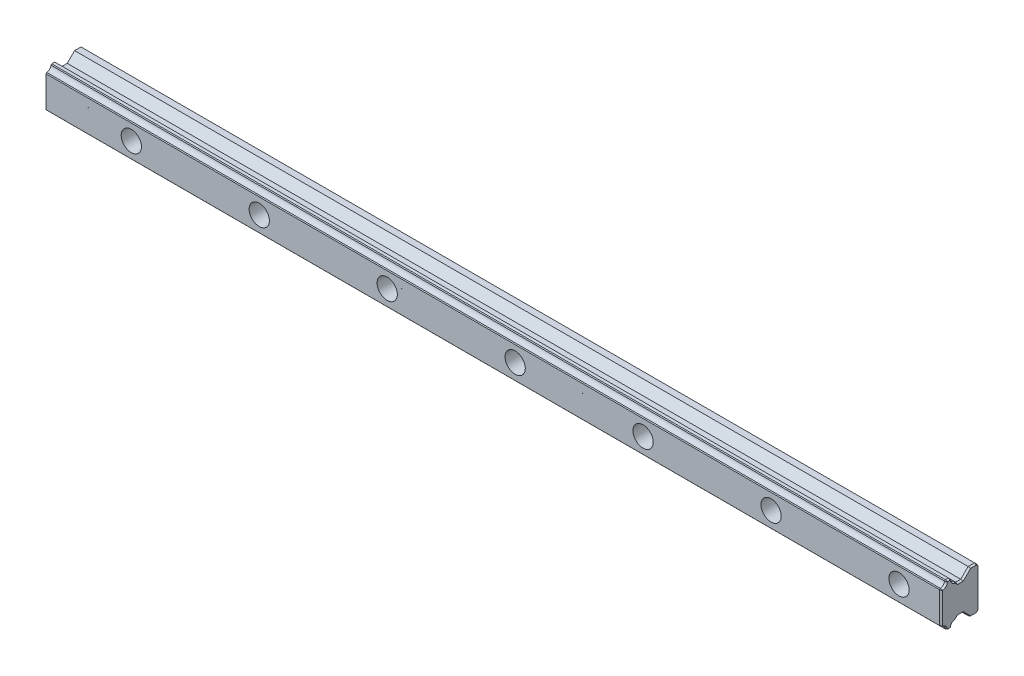
from build123d import *

# Parameters (mm, degrees)
BOSS_EXTRUDE1_DEPTH = 1000
SKETCH2_W           = 1000
SKETCH2_H           = 7.450095573
BOSS_EXTRUDE2_DEPTH = 3.4498578
SKETCH3_W           = 1000
SKETCH3_H           = 3.9997559
BOSS_EXTRUDE3_DEPTH = 3.4501422
DRAFT1_ANGLE        = 45.002080143
DRAFT2_ANGLE        = 45.004001238
HOLE1_D             = 4.26
HOLE2_D             = 6
HOLE2_CBORE_D       = 9.5
HOLE2_CBORE_DEPTH   = 8.4
CHAMFER1_SIZE       = 0.372012979
CHAMFER2_SIZE       = 0.361963418
CHAMFER3_SIZE       = 1
CHAMFER4_SIZE       = 0.371519866
CHAMFER5_SIZE       = 0.363970234
CHAMFER5_SIZE_2     = 1
SKETCH8_W           = 580
SKETCH8_H           = 21.756808221
CUT_EXTRUDE1_DEPTH  = 981.205469728


with BuildPart() as part:
    # Sketch1 → Boss-Extrude1 (new body)
    with BuildSketch(Plane(origin=(980, 0, 0), x_dir=(0, 0, -1), z_dir=(1, 0, 0))):
        with BuildLine():
            Line((-9.879942, -6.5501422), (0, -6.5501422))
            Line((0, -6.5501422), (0, 6.5498578))
            Line((0, 6.5498578), (-9.8792889, 6.5498578))
            Line((-9.8792889, 6.5498578), (-10.98751021, 7.658080112))
            ThreePointArc((-10.98751021, 7.658080112), (-12.443339621, 8.424671607), (-12.918625382, 9.9998558))
            Line((-12.918625382, 9.9998558), (-17.4, 9.9998558))
            Line((-17.4, 9.9998558), (-17.4, -10.0001442))
            Line((-17.4, -10.0001442), (-12.918646144, -10.0001442))
            ThreePointArc((-12.918646144, -10.0001442), (-12.443576435, -8.425447232), (-10.98845212, -7.658651955))
            Line((-10.98845212, -7.658651955), (-9.879942, -6.5501422))
        make_face()
    extrude(amount=-BOSS_EXTRUDE1_DEPTH)

    # Sketch2 → Boss-Extrude2 (add)
    with BuildSketch(Plane.XZ.offset(6.5501422)):
        with Locations((480, 3.725047787)):
            Rectangle(SKETCH2_W, SKETCH2_H)
    extrude(amount=BOSS_EXTRUDE2_DEPTH)

    # Sketch3 → Boss-Extrude3 (add)
    with BuildSketch(Plane(origin=(0, 6.5498578, 0), x_dir=(-1, 0, 0), z_dir=(0, 1, 0))):
        with Locations((-480, 1.99987795)):
            Rectangle(SKETCH3_W, SKETCH3_H)
    extrude(amount=BOSS_EXTRUDE3_DEPTH)

    # Draft1
    draft1_faces = [part.faces().sort_by_distance(p)[0] for p in [
        (480, 8.2749289, 3.9997559),
    ]]
    draft(draft1_faces, Plane.ZX.offset(10), DRAFT1_ANGLE)

    # Draft2
    draft2_faces = [part.faces().sort_by_distance(p)[0] for p in [
        (480, -8.2750711, 7.450095573),
    ]]
    draft(draft2_faces, Plane(origin=(-20, -6.5501422, 9.879942), x_dir=(0, 0, -1), z_dir=(0, -1, 0)), DRAFT2_ANGLE)

    # Hole1 (through all)
    with Locations(Plane.ZY.offset(20)):
        with Locations((17.19973415, 9.78005665), (17.19973415, -9.78030085)):
            Hole(HOLE1_D / 2)

    # Hole2 (through all)
    with Locations(Plane.XY.offset(17.4)):
        with Locations((960, 0), (900, 0), (840, 0), (780, 0), (720, 0), (660, 0), (600, 0), (540, 0), (480, 0), (420, 0), (360, 0), (300, 0), (240, 0), (180, 0), (120, 0), (60, 0), (0, 0)):
            CounterBoreHole(HOLE2_D / 2, HOLE2_CBORE_D / 2, HOLE2_CBORE_DEPTH)

    # Chamfer1
    # the kernel refuses this chamfer: 0.372012979, 0.338849035 mm, written as the material it takes off along each edge
    with BuildSketch(Plane(origin=(980.956699451, -10.0001442, 12.918646144), x_dir=(0, 0, 1), z_dir=(-1, 0, 0))) as chamfer1_piece_1:
        with BuildLine():
            Line((CHAMFER1_SIZE * 0.999999998756, 0), (0.006380544, 0.365632364))
            ThreePointArc((0.006380544, 0.365632364), (0.011135852, 0.187879029), (0, 0))
            Line((0, 0), (CHAMFER1_SIZE * 0.999999998756, 0))
        make_face()
    extrude(amount=1001.913398901, mode=Mode.SUBTRACT)

    # Chamfer2
    # the kernel refuses this chamfer: 0.361963418, 0.332200971, 0.329701008, 0.329695423 mm, written as the material it takes off along each edge
    with BuildSketch(Plane(origin=(-20.930855163, -10.0001442, 15.081109855), x_dir=(0, 0, -1), z_dir=(1, 0, 0))) as chamfer2_piece_1:
        with BuildLine():
            Line((CHAMFER2_SIZE * 0.999999998629, 0), (0.007091411, 0.354872006))
            ThreePointArc((0.007091411, 0.354872006), (0.011045386, 0.182332682), (0, 0))
            Line((0, 0), (CHAMFER2_SIZE * 0.999999998629, 0))
        make_face()
    extrude(amount=1001.861710326, mode=Mode.SUBTRACT)
    with BuildSketch(Plane(origin=(-20.930855163, -7.659736399, 17.4), x_dir=(0, 0.00992372921433692, -0.9999507585868819), z_dir=(1, 0, 0))) as chamfer2_piece_2:
        with BuildLine():
            Line((0.358424162, 0), (CHAMFER2_SIZE * 0.00992372920073, CHAMFER2_SIZE * 0.999950757216))
            Line((CHAMFER2_SIZE * 0.00992372920073, CHAMFER2_SIZE * 0.999950757216), (0, 0))
            ThreePointArc((0, 0), (0.184310403, 0.007546483), (0.358424162, 0))
        make_face()
    extrude(amount=1001.861710326, mode=Mode.SUBTRACT)
    with BuildSketch(Plane(origin=(-20.930855163, 7.659492199, 17.4), x_dir=(0, -1, 0), z_dir=(1, 0, 0))) as chamfer2_piece_3:
        with BuildLine():
            Line((CHAMFER2_SIZE * 0.999999998629, 0), (0.003556904, 0.358406513))
            ThreePointArc((0.003556904, 0.358406513), (0.009375158, 0.184226438), (0, 0))
            Line((0, 0), (CHAMFER2_SIZE * 0.999999998629, 0))
        make_face()
    extrude(amount=1001.861710326, mode=Mode.SUBTRACT)
    with BuildSketch(Plane(origin=(-20.930855163, 9.9998558, 15.081105269), x_dir=(0, -0.9998008523761441, -0.019956342047966567), z_dir=(1, 0, 0))) as chamfer2_piece_4:
        with BuildLine():
            Line((0.35495059, 0), (CHAMFER2_SIZE * 0.0199563420206, CHAMFER2_SIZE * 0.999800851005))
            Line((CHAMFER2_SIZE * 0.0199563420206, CHAMFER2_SIZE * 0.999800851005), (0, 0))
            ThreePointArc((0, 0), (0.182520953, 0.007400676), (0.35495059, 0))
        make_face()
    extrude(amount=1001.861710326, mode=Mode.SUBTRACT)

    # Chamfer3
    chamfer3_edges = [part.edges().sort_by_distance(p)[0] for p in [
        (480, -10, 0),
        (480, 10, 0),
    ]]
    chamfer(chamfer3_edges, length=CHAMFER3_SIZE)

    # Chamfer4
    # the kernel refuses this chamfer: 0.371519866, 0.338374363 mm, written as the material it takes off along each edge
    with BuildSketch(Plane(origin=(980.955431303, 9.9998558, 12.918625382), x_dir=(0, -0.9998437779419388, 0.017675398462010005), z_dir=(-1, 0, 0))) as chamfer4_piece_1:
        with BuildLine():
            Line((0.365123625, 0), (CHAMFER4_SIZE * 0.0176753984456, CHAMFER4_SIZE * 0.999843777013))
            Line((CHAMFER4_SIZE * 0.0176753984456, CHAMFER4_SIZE * 0.999843777013), (0, 0))
            ThreePointArc((0, 0), (0.187754336, 0.007831758), (0.365123625, 0))
        make_face()
    extrude(amount=1001.910862607, mode=Mode.SUBTRACT)

    # Chamfer5
    # the kernel refuses this chamfer: 1, 0.363970234 mm, written as the material it takes off along each edge
    with BuildSketch(Plane(origin=(980, 9.77981245, 10.80002185), x_dir=(0, -0.42648637425097896, -0.9044939870326689), z_dir=(0, 0.9044939870326689, -0.42648637425097896))) as chamfer5_piece_1:
        Polygon((2.13 + CHAMFER5_SIZE, 0), (2.13, CHAMFER5_SIZE_2), (2.13, 0), align=None)
    revolve(axis=Axis((980, 9.77981245, 10.80002185), (-1, 0, 0)), revolution_arc=220.656237873, mode=Mode.SUBTRACT)
    with BuildSketch(Plane(origin=(980, 4.715484283, 8.044917043), x_dir=(0, -0.7071064613613919, 0.7071071010115584), z_dir=(0, 0.7071071010115584, 0.7071064613613921))) as chamfer5_piece_2_section:
        Polygon((CHAMFER5_SIZE, 0), (0, -CHAMFER5_SIZE_2), (0, 0), align=None)
    chamfer5_piece_2 = extrude(amount=6.75565178, mode=Mode.PRIVATE)
    chamfer5_piece_2 = split(chamfer5_piece_2, bisect_by=Plane(origin=(980, 6.5498578, 8.044917043), z_dir=(0, 1, 0)), keep=Keep.TOP, mode=Mode.PRIVATE)
    add(chamfer5_piece_2, mode=Mode.SUBTRACT)
    with BuildSketch(Plane(origin=(980, -6.5501422, 12.474136733), x_dir=(0, 1, 0), z_dir=(0, 0, -1))) as chamfer5_piece_3_section:
        Polygon((CHAMFER5_SIZE, 0), (0, -CHAMFER5_SIZE_2), (0, 0), align=None)
    chamfer5_piece_3 = extrude(amount=7.618235892, mode=Mode.PRIVATE)
    chamfer5_piece_3 = split(chamfer5_piece_3, bisect_by=Plane(origin=(980, -4.038121645, 9.962467006), z_dir=(0, -0.7071561601012581, 0.7070573988233514)), keep=Keep.TOP, mode=Mode.PRIVATE)
    chamfer5_piece_3 = split(chamfer5_piece_3, bisect_by=Plane(origin=(980, -7.847239567, 11.177039793), z_dir=(0, -0.7071068974739103, -0.7071066648991656)), keep=Keep.TOP, mode=Mode.PRIVATE)
    add(chamfer5_piece_3, mode=Mode.SUBTRACT)
    with BuildSketch(Plane(origin=(980, -9.493024341, 12.822825109), x_dir=(0, 0.7071068974739103, 0.7071066648991655), z_dir=(0, 0.7071066648991656, -0.7071068974739103))) as chamfer5_piece_4_section:
        Polygon((CHAMFER5_SIZE, 0), (0, -CHAMFER5_SIZE_2), (0, 0), align=None)
    chamfer5_piece_4 = extrude(amount=6.756059252, mode=Mode.PRIVATE)
    chamfer5_piece_4 = split(chamfer5_piece_4, bisect_by=Plane(origin=(980, -6.5501422, 12.822825109), z_dir=(0, -1, 0)), keep=Keep.TOP, mode=Mode.PRIVATE)
    add(chamfer5_piece_4, mode=Mode.SUBTRACT)
    with BuildSketch(Plane(origin=(980, -9.78030085, 10.80002185), x_dir=(0, -0.9126940639173625, 0.4086435435560058), z_dir=(0, -0.4086435435560058, -0.9126940639173625))) as chamfer5_piece_5:
        Polygon((2.13 + CHAMFER5_SIZE, 0), (2.13, CHAMFER5_SIZE_2), (2.13, 0), align=None)
    revolve(axis=Axis((980, -9.78030085, 10.80002185), (-1, 0, 0)), revolution_arc=220.610102929, mode=Mode.SUBTRACT)
    with BuildSketch(Plane(origin=(980, -11.834516709, 15.125031988), x_dir=(0, 0.7071068497715801, 0.7071067126015084), z_dir=(0, 0.7071067126015084, -0.70710684977158))) as chamfer5_piece_6:
        Polygon((CHAMFER5_SIZE, 0), (0, -CHAMFER5_SIZE_2), (0, 0), align=None)
    extrude(amount=5.705471763, mode=Mode.SUBTRACT)
    with BuildSketch(Plane(origin=(980, 9.78005665, 17.19973415), x_dir=(4.803669199504906e-13, 0.9147457522504255, -0.40402996020072945), z_dir=(2.0897664314390657e-13, 0.40402996020072945, 0.9147457522504255))) as chamfer5_piece_7:
        Polygon((2.13 + CHAMFER5_SIZE, 0), (2.13, CHAMFER5_SIZE_2), (2.13, 0), align=None)
    revolve(axis=Axis((980, 9.78005665, 17.19973415), (-1, 0, 0)), revolution_arc=221.717516402, mode=Mode.SUBTRACT)
    with BuildSketch(Plane(origin=(980, -10.0001442, 17.313341171), x_dir=(0, 1, 0), z_dir=(0, 0, -1)), Plane(origin=(-20, -10.0001442, 17.313341171), x_dir=(1, 0, 0), z_dir=(0, 0, -1))) as chamfer5_piece_8:
        Polygon((CHAMFER5_SIZE, 0), (0, -CHAMFER5_SIZE_2), (0, 0), align=None)
    extrude(amount=6.61687678, mode=Mode.SUBTRACT)
    with BuildSketch(Plane(origin=(980, 9.891723514, 17.4), x_dir=(0, 0, -1), z_dir=(0, -1, 0)), Plane(origin=(-20, 9.891723514, 17.4), x_dir=(1, 0, 0), z_dir=(0, -1, 0))) as chamfer5_piece_9:
        Polygon((CHAMFER5_SIZE, 0), (0, -CHAMFER5_SIZE_2), (0, 0), align=None)
    extrude(amount=19.783691229, mode=Mode.SUBTRACT)
    with BuildSketch(Plane(origin=(980, -9.78030085, 17.19973415), x_dir=(0, 0.4139328204995242, 0.910307431647852), z_dir=(-4.8803031300112123e-14, -0.910307431647852, 0.4139328204995242))) as chamfer5_piece_10:
        Polygon((2.13 + CHAMFER5_SIZE, 0), (2.13, CHAMFER5_SIZE_2), (2.13, 0), align=None)
    revolve(axis=Axis((980, -9.78030085, 17.19973415), (-1, 0, 0)), revolution_arc=221.718922177, mode=Mode.SUBTRACT)
    with BuildSketch(Plane(origin=(980, -5.463400295, 19.234372687), x_dir=(0, 0.7071067811866485, -0.7071067811864467), z_dir=(0, -0.7071067811864467, -0.7071067811866485)), Plane(origin=(980, 9.490307982, 15.2072208), x_dir=(0, -0.7071067811858096, -0.7071067811872856), z_dir=(0, -0.7071067811872856, 0.7071067811858095))) as chamfer5_piece_11:
        Polygon((CHAMFER5_SIZE, 0), (0, -CHAMFER5_SIZE_2), (0, 0), align=None)
    extrude(amount=5.695252817, mode=Mode.SUBTRACT)
    with BuildSketch(Plane(origin=(980, -7.810899507, 16.908391131), x_dir=(-3.123520195293368e-13, 0.7071067811862966, -0.7071067811867984), z_dir=(0, -0.7071067811867985, -0.7071067811862967))) as chamfer5_piece_12:
        Polygon((CHAMFER5_SIZE, 0), (0, -CHAMFER5_SIZE_2), (0, 0), align=None)
    extrude(amount=5.690254269, mode=Mode.SUBTRACT)
    with BuildSketch(Plane(origin=(980, 11.834228487, 12.884769165), x_dir=(0, -0.7071067811866217, -0.7071067811864734), z_dir=(0, -0.7071067811864734, 0.7071067811866217))) as chamfer5_piece_13:
        Polygon((CHAMFER5_SIZE, 0), (0, -CHAMFER5_SIZE_2), (0, 0), align=None)
    extrude(amount=5.690265436, mode=Mode.SUBTRACT)
    with BuildSketch(Plane(origin=(980, -10, 6.593950633), x_dir=(0, 1, 0), z_dir=(0, 0, -1)), Plane(origin=(980, 10, -1.594194733), x_dir=(0, -1, 0), z_dir=(0, 0, 1))) as chamfer5_piece_14:
        Polygon((CHAMFER5_SIZE, 0), (0, -CHAMFER5_SIZE_2), (0, 0), align=None)
    extrude(amount=8.188145365, mode=Mode.SUBTRACT)
    with BuildSketch(Plane(origin=(980, -11.594194733, 0), x_dir=(0, 0, 1), z_dir=(0, 1, 0))) as chamfer5_piece_15:
        Polygon((CHAMFER5_SIZE, 0), (0, -CHAMFER5_SIZE_2), (0, 0), align=None)
    extrude(amount=23.188389465, mode=Mode.SUBTRACT)
    with BuildSketch(Plane(origin=(980, 11.834372687, 2.834372687), x_dir=(-3.123520195293376e-13, -0.7071067811865475, 0.7071067811865475), z_dir=(0, -0.7071067811865476, -0.7071067811865476)), Plane(origin=(980, -7.165627313, -1.834372687), x_dir=(0, 0.7071067811865476, 0.7071067811865476), z_dir=(0, -0.7071067811865476, 0.7071067811865476)), Plane(origin=(-20, 11.834372687, 2.834372687), x_dir=(1, 0, 0), z_dir=(0, -0.7071067811865476, -0.7071067811865476)), Plane(origin=(-20, -7.165627313, -1.834372687), x_dir=(1, 0, 0), z_dir=(0, -0.7071067811865476, 0.7071067811865476))) as chamfer5_piece_16:
        Polygon((CHAMFER5_SIZE, 0), (0, CHAMFER5_SIZE_2), (0, 0), align=None)
    extrude(amount=6.602603027, mode=Mode.SUBTRACT)
    with BuildSketch(Plane(origin=(980, 9.9998558, 10.695950515), x_dir=(0, -1, 0), z_dir=(0, 0, 1)), Plane(origin=(-20, 9.9998558, 10.695950515), x_dir=(1, 0, 0), z_dir=(0, 0, 1))) as chamfer5_piece_17:
        Polygon((CHAMFER5_SIZE, 0), (0, -CHAMFER5_SIZE_2), (0, 0), align=None)
    extrude(amount=6.61738607, mode=Mode.SUBTRACT)
    with BuildSketch(Plane(origin=(980, 7.80041546, 11.090707467), x_dir=(0, -0.7071063697090587, 0.707107192663797), z_dir=(0, 0.7071071926637971, 0.7071063697090587))) as chamfer5_piece_18:
        Polygon((CHAMFER5_SIZE, 0), (0, -CHAMFER5_SIZE_2), (0, 0), align=None)
    extrude(amount=5.70467128, mode=Mode.SUBTRACT)
    with BuildSketch(Plane(origin=(980, -4.715897621, 9.284596359), x_dir=(0, 0.7071561601012583, -0.7070573988233513), z_dir=(0, -0.7070573988233514, -0.7071561601012581))) as chamfer5_piece_19_section:
        Polygon((CHAMFER5_SIZE, 0), (0, -CHAMFER5_SIZE_2), (0, 0), align=None)
    chamfer5_piece_19 = extrude(amount=10.067565902, mode=Mode.PRIVATE)
    chamfer5_piece_19 = split(chamfer5_piece_19, bisect_by=Plane(origin=(980, -6.5501422, 9.284596359), z_dir=(0, -1, 0)), keep=Keep.TOP, mode=Mode.PRIVATE)
    add(chamfer5_piece_19, mode=Mode.SUBTRACT)
    with BuildSketch(Plane(origin=(980, 6.5498578, 4.855953894), x_dir=(0, -1, 0), z_dir=(0, 0, 1))) as chamfer5_piece_20_section:
        Polygon((CHAMFER5_SIZE, 0), (0, -CHAMFER5_SIZE_2), (0, 0), align=None)
    chamfer5_piece_20 = extrude(amount=7.617529739, mode=Mode.PRIVATE)
    chamfer5_piece_20 = split(chamfer5_piece_20, bisect_by=Plane(origin=(980, 4.038190297, 7.367623669), z_dir=(0, 0.7071064613613921, -0.7071071010115584)), keep=Keep.TOP, mode=Mode.PRIVATE)
    chamfer5_piece_20 = split(chamfer5_piece_20, bisect_by=Plane(origin=(980, 7.846955163, 6.152957077), z_dir=(0, 0.7071324524796995, 0.7070811089613734)), keep=Keep.TOP, mode=Mode.PRIVATE)
    add(chamfer5_piece_20, mode=Mode.SUBTRACT)
    with BuildSketch(Plane(origin=(980, 4.715551711, 9.28458791), x_dir=(0, -0.7071324524796995, -0.7070811089613733), z_dir=(0, 0.7070811089613734, -0.7071324524796995))) as chamfer5_piece_21_section:
        Polygon((CHAMFER5_SIZE, 0), (0, CHAMFER5_SIZE_2), (0, 0), align=None)
    chamfer5_piece_21 = extrude(amount=10.067804509, mode=Mode.PRIVATE)
    chamfer5_piece_21 = split(chamfer5_piece_21, bisect_by=Plane(origin=(980, 6.5498578, 9.28458791), z_dir=(0, 1, 0)), keep=Keep.TOP, mode=Mode.PRIVATE)
    add(chamfer5_piece_21, mode=Mode.SUBTRACT)
    with BuildSketch(Plane(origin=(-20, 4.715484283, 8.044917043), x_dir=(1, 0, 0), z_dir=(0, 0.7071071010115584, 0.7071064613613921))) as chamfer5_piece_22_section:
        Polygon((CHAMFER5_SIZE, 0), (0, -CHAMFER5_SIZE_2), (0, 0), align=None)
    chamfer5_piece_22 = extrude(amount=6.75565178, mode=Mode.PRIVATE)
    chamfer5_piece_22 = split(chamfer5_piece_22, bisect_by=Plane(origin=(-20, 6.5498578, 8.044917043), z_dir=(0, 1, 0)), keep=Keep.TOP, mode=Mode.PRIVATE)
    add(chamfer5_piece_22, mode=Mode.SUBTRACT)
    with BuildSketch(Plane(origin=(-20, -9.78030085, 10.80002185), x_dir=(0, -0.9126940639173421, 0.4086435435560518), z_dir=(0, -0.4086435435560518, -0.9126940639173421))) as chamfer5_piece_23:
        Polygon((2.13, -CHAMFER5_SIZE), (2.13 + CHAMFER5_SIZE_2, 0), (2.13, 0), align=None)
    revolve(axis=Axis((-20, -9.78030085, 10.80002185), (-1, 0, 0)), revolution_arc=220.610102929, mode=Mode.SUBTRACT)
    with BuildSketch(Plane(origin=(-20, 9.77981245, 10.80002185), x_dir=(0, -0.42648637425102415, -0.9044939870326476), z_dir=(0, 0.9044939870326476, -0.42648637425102415))) as chamfer5_piece_24:
        Polygon((2.13, -CHAMFER5_SIZE), (2.13 + CHAMFER5_SIZE_2, 0), (2.13, 0), align=None)
    revolve(axis=Axis((-20, 9.77981245, 10.80002185), (-1, 0, 0)), revolution_arc=220.656237873, mode=Mode.SUBTRACT)
    with BuildSketch(Plane(origin=(-20, 9.78005665, 17.19973415), x_dir=(0, -0.41393283318023105, 0.9103074258817112), z_dir=(0, 0.9103074258817112, 0.41393283318023105))) as chamfer5_piece_25:
        Polygon((2.13, CHAMFER5_SIZE), (2.13 + CHAMFER5_SIZE_2, 0), (2.13, 0), align=None)
    revolve(axis=Axis((-20, 9.78005665, 17.19973415), (1, 0, 0)), revolution_arc=221.717516402, mode=Mode.SUBTRACT)
    with BuildSketch(Plane(origin=(-20, -9.78030085, 17.19973415), x_dir=(0, -0.9147556593909055, -0.40400752915299676), z_dir=(0, -0.40400752915299676, 0.9147556593909055))) as chamfer5_piece_26:
        Polygon((2.13, CHAMFER5_SIZE), (2.13 + CHAMFER5_SIZE_2, 0), (2.13, 0), align=None)
    revolve(axis=Axis((-20, -9.78030085, 17.19973415), (1, 0, 0)), revolution_arc=221.718922177, mode=Mode.SUBTRACT)
    with BuildSketch(Plane(origin=(-20, 11.594194733, 0), x_dir=(1, 0, 0), z_dir=(0, -1, 0))) as chamfer5_piece_27:
        Polygon((CHAMFER5_SIZE, 0), (0, CHAMFER5_SIZE_2), (0, 0), align=None)
    extrude(amount=23.188389465, mode=Mode.SUBTRACT)
    with BuildSketch(Plane(origin=(-20, 10, 6.593950633), x_dir=(1, 0, 0), z_dir=(0, 0, -1)), Plane(origin=(-20, -10, -1.594194733), x_dir=(1, 0, 0), z_dir=(0, 0, 1))) as chamfer5_piece_28:
        Polygon((CHAMFER5_SIZE, 0), (0, CHAMFER5_SIZE_2), (0, 0), align=None)
    extrude(amount=8.188145365, mode=Mode.SUBTRACT)
    with BuildSketch(Plane(origin=(-20, -4.715897621, 9.284596359), x_dir=(1, 0, 0), z_dir=(0, -0.7070573988233514, -0.7071561601012581))) as chamfer5_piece_29_section:
        Polygon((CHAMFER5_SIZE, 0), (0, -CHAMFER5_SIZE_2), (0, 0), align=None)
    chamfer5_piece_29 = extrude(amount=10.067565902, mode=Mode.PRIVATE)
    chamfer5_piece_29 = split(chamfer5_piece_29, bisect_by=Plane(origin=(-20, -6.5501422, 9.284596359), z_dir=(0, -1, 0)), keep=Keep.TOP, mode=Mode.PRIVATE)
    add(chamfer5_piece_29, mode=Mode.SUBTRACT)
    with BuildSketch(Plane(origin=(-20, 6.5498578, 4.855953894), x_dir=(1, 0, 0), z_dir=(0, 0, 1))) as chamfer5_piece_30_section:
        Polygon((CHAMFER5_SIZE, 0), (0, -CHAMFER5_SIZE_2), (0, 0), align=None)
    chamfer5_piece_30 = extrude(amount=7.617529739, mode=Mode.PRIVATE)
    chamfer5_piece_30 = split(chamfer5_piece_30, bisect_by=Plane(origin=(-20, 4.038190297, 7.367623669), z_dir=(0, 0.7071064613613921, -0.7071071010115584)), keep=Keep.TOP, mode=Mode.PRIVATE)
    chamfer5_piece_30 = split(chamfer5_piece_30, bisect_by=Plane(origin=(-20, 7.846955163, 6.152957077), z_dir=(0, 0.7071324524796995, 0.7070811089613734)), keep=Keep.TOP, mode=Mode.PRIVATE)
    add(chamfer5_piece_30, mode=Mode.SUBTRACT)
    with BuildSketch(Plane(origin=(-20, 4.715551711, 9.28458791), x_dir=(1, 0, 0), z_dir=(0, 0.7070811089613734, -0.7071324524796995))) as chamfer5_piece_31_section:
        Polygon((CHAMFER5_SIZE, 0), (0, CHAMFER5_SIZE_2), (0, 0), align=None)
    chamfer5_piece_31 = extrude(amount=10.067804509, mode=Mode.PRIVATE)
    chamfer5_piece_31 = split(chamfer5_piece_31, bisect_by=Plane(origin=(-20, 6.5498578, 9.28458791), z_dir=(0, 1, 0)), keep=Keep.TOP, mode=Mode.PRIVATE)
    add(chamfer5_piece_31, mode=Mode.SUBTRACT)
    with BuildSketch(Plane(origin=(-20, -9.493024341, 12.822825109), x_dir=(1, 0, 0), z_dir=(0, 0.7071066648991656, -0.7071068974739103))) as chamfer5_piece_32_section:
        Polygon((CHAMFER5_SIZE, 0), (0, -CHAMFER5_SIZE_2), (0, 0), align=None)
    chamfer5_piece_32 = extrude(amount=6.756059252, mode=Mode.PRIVATE)
    chamfer5_piece_32 = split(chamfer5_piece_32, bisect_by=Plane(origin=(-20, -6.5501422, 12.822825109), z_dir=(0, -1, 0)), keep=Keep.TOP, mode=Mode.PRIVATE)
    add(chamfer5_piece_32, mode=Mode.SUBTRACT)
    with BuildSketch(Plane(origin=(-20, -6.5501422, 12.474136733), x_dir=(1, 0, 0), z_dir=(0, 0, -1))) as chamfer5_piece_33_section:
        Polygon((CHAMFER5_SIZE, 0), (0, -CHAMFER5_SIZE_2), (0, 0), align=None)
    chamfer5_piece_33 = extrude(amount=7.618235892, mode=Mode.PRIVATE)
    chamfer5_piece_33 = split(chamfer5_piece_33, bisect_by=Plane(origin=(-20, -4.038121645, 9.962467006), z_dir=(0, -0.7071561601012581, 0.7070573988233514)), keep=Keep.TOP, mode=Mode.PRIVATE)
    chamfer5_piece_33 = split(chamfer5_piece_33, bisect_by=Plane(origin=(-20, -7.847239567, 11.177039793), z_dir=(0, -0.7071068974739103, -0.7071066648991656)), keep=Keep.TOP, mode=Mode.PRIVATE)
    add(chamfer5_piece_33, mode=Mode.SUBTRACT)
    with BuildSketch(Plane(origin=(980, 4.715484283, 8.044917043), x_dir=(0, -0.7071064613613919, 0.7071071010115584), z_dir=(0, 0.7071071010115584, 0.7071064613613921))) as chamfer5_piece_34a_section:
        Polygon((CHAMFER5_SIZE, 0), (0, -CHAMFER5_SIZE_2), (0, 0), align=None)
    chamfer5_piece_34a = extrude(amount=6.75565178, mode=Mode.PRIVATE)
    chamfer5_piece_34a = split(chamfer5_piece_34a, bisect_by=Plane(origin=(980, 6.5498578, 8.044917043), z_dir=(0, -1, 0)), keep=Keep.TOP, mode=Mode.PRIVATE)
    with BuildSketch(Plane(origin=(980, 6.5498578, 4.855953894), x_dir=(0, -1, 0), z_dir=(0, 0, 1))) as chamfer5_piece_34b_section:
        Polygon((CHAMFER5_SIZE, 0), (0, -CHAMFER5_SIZE_2), (0, 0), align=None)
    chamfer5_piece_34b = extrude(amount=7.617529739, mode=Mode.PRIVATE)
    chamfer5_piece_34b = split(chamfer5_piece_34b, bisect_by=Plane(origin=(980, 4.038190297, 7.367623669), z_dir=(0, -0.7071064613613921, 0.7071071010115584)), keep=Keep.TOP, mode=Mode.PRIVATE)
    chamfer5_piece_34 = chamfer5_piece_34a & chamfer5_piece_34b
    add(chamfer5_piece_34, mode=Mode.SUBTRACT)
    with BuildSketch(Plane(origin=(980, -6.5501422, 12.474136733), x_dir=(0, 1, 0), z_dir=(0, 0, -1))) as chamfer5_piece_35a_section:
        Polygon((CHAMFER5_SIZE, 0), (0, -CHAMFER5_SIZE_2), (0, 0), align=None)
    chamfer5_piece_35a = extrude(amount=7.618235892, mode=Mode.PRIVATE)
    chamfer5_piece_35a = split(chamfer5_piece_35a, bisect_by=Plane(origin=(980, -7.847239567, 11.177039793), z_dir=(0, 0.7071068974739103, 0.7071066648991656)), keep=Keep.TOP, mode=Mode.PRIVATE)
    with BuildSketch(Plane(origin=(980, -9.493024341, 12.822825109), x_dir=(0, 0.7071068974739103, 0.7071066648991655), z_dir=(0, 0.7071066648991656, -0.7071068974739103))) as chamfer5_piece_35b_section:
        Polygon((CHAMFER5_SIZE, 0), (0, -CHAMFER5_SIZE_2), (0, 0), align=None)
    chamfer5_piece_35b = extrude(amount=6.756059252, mode=Mode.PRIVATE)
    chamfer5_piece_35b = split(chamfer5_piece_35b, bisect_by=Plane(origin=(980, -6.5501422, 12.822825109), z_dir=(0, 1, 0)), keep=Keep.TOP, mode=Mode.PRIVATE)
    chamfer5_piece_35 = chamfer5_piece_35a & chamfer5_piece_35b
    add(chamfer5_piece_35, mode=Mode.SUBTRACT)
    with BuildSketch(Plane(origin=(980, -4.715897621, 9.284596359), x_dir=(0, 0.7071561601012583, -0.7070573988233513), z_dir=(0, -0.7070573988233514, -0.7071561601012581))) as chamfer5_piece_36a_section:
        Polygon((CHAMFER5_SIZE, 0), (0, -CHAMFER5_SIZE_2), (0, 0), align=None)
    chamfer5_piece_36a = extrude(amount=10.067565902, mode=Mode.PRIVATE)
    chamfer5_piece_36a = split(chamfer5_piece_36a, bisect_by=Plane(origin=(980, -6.5501422, 9.284596359), z_dir=(0, 1, 0)), keep=Keep.TOP, mode=Mode.PRIVATE)
    with BuildSketch(Plane(origin=(980, -6.5501422, 12.474136733), x_dir=(0, 1, 0), z_dir=(0, 0, -1))) as chamfer5_piece_36b_section:
        Polygon((CHAMFER5_SIZE, 0), (0, -CHAMFER5_SIZE_2), (0, 0), align=None)
    chamfer5_piece_36b = extrude(amount=7.618235892, mode=Mode.PRIVATE)
    chamfer5_piece_36b = split(chamfer5_piece_36b, bisect_by=Plane(origin=(980, -4.038121645, 9.962467006), z_dir=(0, 0.7071561601012581, -0.7070573988233514)), keep=Keep.TOP, mode=Mode.PRIVATE)
    chamfer5_piece_36 = chamfer5_piece_36a & chamfer5_piece_36b
    add(chamfer5_piece_36, mode=Mode.SUBTRACT)
    with BuildSketch(Plane(origin=(980, 6.5498578, 4.855953894), x_dir=(0, -1, 0), z_dir=(0, 0, 1))) as chamfer5_piece_37a_section:
        Polygon((CHAMFER5_SIZE, 0), (0, -CHAMFER5_SIZE_2), (0, 0), align=None)
    chamfer5_piece_37a = extrude(amount=7.617529739, mode=Mode.PRIVATE)
    chamfer5_piece_37a = split(chamfer5_piece_37a, bisect_by=Plane(origin=(980, 7.846955163, 6.152957077), z_dir=(0, -0.7071324524796995, -0.7070811089613734)), keep=Keep.TOP, mode=Mode.PRIVATE)
    with BuildSketch(Plane(origin=(980, 4.715551711, 9.28458791), x_dir=(0, -0.7071324524796995, -0.7070811089613733), z_dir=(0, 0.7070811089613734, -0.7071324524796995))) as chamfer5_piece_37b_section:
        Polygon((CHAMFER5_SIZE, 0), (0, CHAMFER5_SIZE_2), (0, 0), align=None)
    chamfer5_piece_37b = extrude(amount=10.067804509, mode=Mode.PRIVATE)
    chamfer5_piece_37b = split(chamfer5_piece_37b, bisect_by=Plane(origin=(980, 6.5498578, 9.28458791), z_dir=(0, -1, 0)), keep=Keep.TOP, mode=Mode.PRIVATE)
    chamfer5_piece_37 = chamfer5_piece_37a & chamfer5_piece_37b
    add(chamfer5_piece_37, mode=Mode.SUBTRACT)
    with BuildSketch(Plane(origin=(-20, 4.715484283, 8.044917043), x_dir=(1, 0, 0), z_dir=(0, 0.7071071010115584, 0.7071064613613921))) as chamfer5_piece_38a_section:
        Polygon((CHAMFER5_SIZE, 0), (0, -CHAMFER5_SIZE_2), (0, 0), align=None)
    chamfer5_piece_38a = extrude(amount=6.75565178, mode=Mode.PRIVATE)
    chamfer5_piece_38a = split(chamfer5_piece_38a, bisect_by=Plane(origin=(-20, 6.5498578, 8.044917043), z_dir=(0, -1, 0)), keep=Keep.TOP, mode=Mode.PRIVATE)
    with BuildSketch(Plane(origin=(-20, 6.5498578, 4.855953894), x_dir=(1, 0, 0), z_dir=(0, 0, 1))) as chamfer5_piece_38b_section:
        Polygon((CHAMFER5_SIZE, 0), (0, -CHAMFER5_SIZE_2), (0, 0), align=None)
    chamfer5_piece_38b = extrude(amount=7.617529739, mode=Mode.PRIVATE)
    chamfer5_piece_38b = split(chamfer5_piece_38b, bisect_by=Plane(origin=(-20, 4.038190297, 7.367623669), z_dir=(0, -0.7071064613613921, 0.7071071010115584)), keep=Keep.TOP, mode=Mode.PRIVATE)
    chamfer5_piece_38 = chamfer5_piece_38a & chamfer5_piece_38b
    add(chamfer5_piece_38, mode=Mode.SUBTRACT)
    with BuildSketch(Plane(origin=(-20, -4.715897621, 9.284596359), x_dir=(1, 0, 0), z_dir=(0, -0.7070573988233514, -0.7071561601012581))) as chamfer5_piece_39a_section:
        Polygon((CHAMFER5_SIZE, 0), (0, -CHAMFER5_SIZE_2), (0, 0), align=None)
    chamfer5_piece_39a = extrude(amount=10.067565902, mode=Mode.PRIVATE)
    chamfer5_piece_39a = split(chamfer5_piece_39a, bisect_by=Plane(origin=(-20, -6.5501422, 9.284596359), z_dir=(0, 1, 0)), keep=Keep.TOP, mode=Mode.PRIVATE)
    with BuildSketch(Plane(origin=(-20, -6.5501422, 12.474136733), x_dir=(1, 0, 0), z_dir=(0, 0, -1))) as chamfer5_piece_39b_section:
        Polygon((CHAMFER5_SIZE, 0), (0, -CHAMFER5_SIZE_2), (0, 0), align=None)
    chamfer5_piece_39b = extrude(amount=7.618235892, mode=Mode.PRIVATE)
    chamfer5_piece_39b = split(chamfer5_piece_39b, bisect_by=Plane(origin=(-20, -4.038121645, 9.962467006), z_dir=(0, 0.7071561601012581, -0.7070573988233514)), keep=Keep.TOP, mode=Mode.PRIVATE)
    chamfer5_piece_39 = chamfer5_piece_39a & chamfer5_piece_39b
    add(chamfer5_piece_39, mode=Mode.SUBTRACT)
    with BuildSketch(Plane(origin=(-20, 6.5498578, 4.855953894), x_dir=(1, 0, 0), z_dir=(0, 0, 1))) as chamfer5_piece_40a_section:
        Polygon((CHAMFER5_SIZE, 0), (0, -CHAMFER5_SIZE_2), (0, 0), align=None)
    chamfer5_piece_40a = extrude(amount=7.617529739, mode=Mode.PRIVATE)
    chamfer5_piece_40a = split(chamfer5_piece_40a, bisect_by=Plane(origin=(-20, 7.846955163, 6.152957077), z_dir=(0, -0.7071324524796995, -0.7070811089613734)), keep=Keep.TOP, mode=Mode.PRIVATE)
    with BuildSketch(Plane(origin=(-20, 4.715551711, 9.28458791), x_dir=(1, 0, 0), z_dir=(0, 0.7070811089613734, -0.7071324524796995))) as chamfer5_piece_40b_section:
        Polygon((CHAMFER5_SIZE, 0), (0, CHAMFER5_SIZE_2), (0, 0), align=None)
    chamfer5_piece_40b = extrude(amount=10.067804509, mode=Mode.PRIVATE)
    chamfer5_piece_40b = split(chamfer5_piece_40b, bisect_by=Plane(origin=(-20, 6.5498578, 9.28458791), z_dir=(0, -1, 0)), keep=Keep.TOP, mode=Mode.PRIVATE)
    chamfer5_piece_40 = chamfer5_piece_40a & chamfer5_piece_40b
    add(chamfer5_piece_40, mode=Mode.SUBTRACT)
    with BuildSketch(Plane(origin=(-20, -6.5501422, 12.474136733), x_dir=(1, 0, 0), z_dir=(0, 0, -1))) as chamfer5_piece_41a_section:
        Polygon((CHAMFER5_SIZE, 0), (0, -CHAMFER5_SIZE_2), (0, 0), align=None)
    chamfer5_piece_41a = extrude(amount=7.618235892, mode=Mode.PRIVATE)
    chamfer5_piece_41a = split(chamfer5_piece_41a, bisect_by=Plane(origin=(-20, -7.847239567, 11.177039793), z_dir=(0, 0.7071068974739103, 0.7071066648991656)), keep=Keep.TOP, mode=Mode.PRIVATE)
    with BuildSketch(Plane(origin=(-20, -9.493024341, 12.822825109), x_dir=(1, 0, 0), z_dir=(0, 0.7071066648991656, -0.7071068974739103))) as chamfer5_piece_41b_section:
        Polygon((CHAMFER5_SIZE, 0), (0, -CHAMFER5_SIZE_2), (0, 0), align=None)
    chamfer5_piece_41b = extrude(amount=6.756059252, mode=Mode.PRIVATE)
    chamfer5_piece_41b = split(chamfer5_piece_41b, bisect_by=Plane(origin=(-20, -6.5501422, 12.822825109), z_dir=(0, 1, 0)), keep=Keep.TOP, mode=Mode.PRIVATE)
    chamfer5_piece_41 = chamfer5_piece_41a & chamfer5_piece_41b
    add(chamfer5_piece_41, mode=Mode.SUBTRACT)

    # Sketch8 → Cut-Extrude1 (cut, through all)
    with BuildSketch(Plane.XY.offset(17.4)):
        with Locations((270, 0.87825991)):
            Rectangle(SKETCH8_W, SKETCH8_H)
    extrude(amount=-CUT_EXTRUDE1_DEPTH, mode=Mode.SUBTRACT)


solid = part.part
